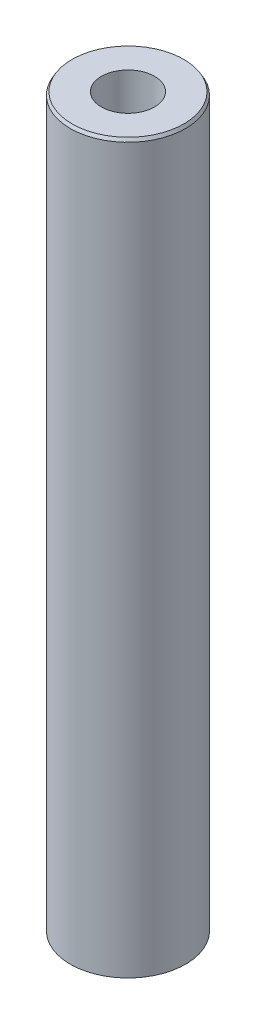
from build123d import *
from OCP.BRepFilletAPI import BRepFilletAPI_MakeChamfer

# Parameters (mm, degrees)
SKETCH1_R           = 47.5
BOSS_EXTRUDE1_DEPTH = 600
SKETCH2_R           = 21.882581708
CUT_EXTRUDE1_DEPTH  = 604.748706003
CHAMFER1_SIZE       = 2.546461521
CHAMFER1_SIZE2      = 1.470200245


with BuildPart() as part:
    # Sketch1 → Boss-Extrude1 (new body)
    with BuildSketch(Plane(origin=(0, 0, 0), x_dir=(1, 0, 0), z_dir=(0, 1, 0))):
        Circle(SKETCH1_R)
    extrude(amount=BOSS_EXTRUDE1_DEPTH)

    # Sketch2 → Cut-Extrude1 (cut, through all)
    with BuildSketch(Plane(origin=(0, 0, 0), x_dir=(1, 0, 0), z_dir=(0, 1, 0))):
        Circle(SKETCH2_R)
    extrude(amount=CUT_EXTRUDE1_DEPTH, mode=Mode.SUBTRACT)

    # Chamfer1: one chamfer whose edges measure the first distance from different faces: ONE call of the kernel's chamfer builder (chamfer() names one face for all edges)
    chamfer1_edges_1 = [part.edges().sort_by_distance(p)[0] for p in [
        (-47.5, 600, 0),
    ]]
    chamfer1_side_1 = [part.faces().sort_by_distance(p)[0] for p in [
        (-47.5, 300, 0),
    ]]
    chamfer1_edges_2 = [part.edges().sort_by_distance(p)[0] for p in [
        (-47.5, 0, 0),
    ]]
    chamfer1_side_2 = [part.faces().sort_by_distance(p)[0] for p in [
        (-46.156497116, 0, 0),
    ]]
    chamfer1 = BRepFilletAPI_MakeChamfer(part.part.solid().wrapped)
    for e in chamfer1_edges_1:
        chamfer1.Add(CHAMFER1_SIZE, CHAMFER1_SIZE2, e.wrapped, chamfer1_side_1[0].wrapped)  # the first distance lies on this face
    for e in chamfer1_edges_2:
        chamfer1.Add(CHAMFER1_SIZE, CHAMFER1_SIZE2, e.wrapped, chamfer1_side_2[0].wrapped)  # the first distance lies on this face
    add(Compound.cast(chamfer1.Shape()), mode=Mode.REPLACE)


solid = part.part
